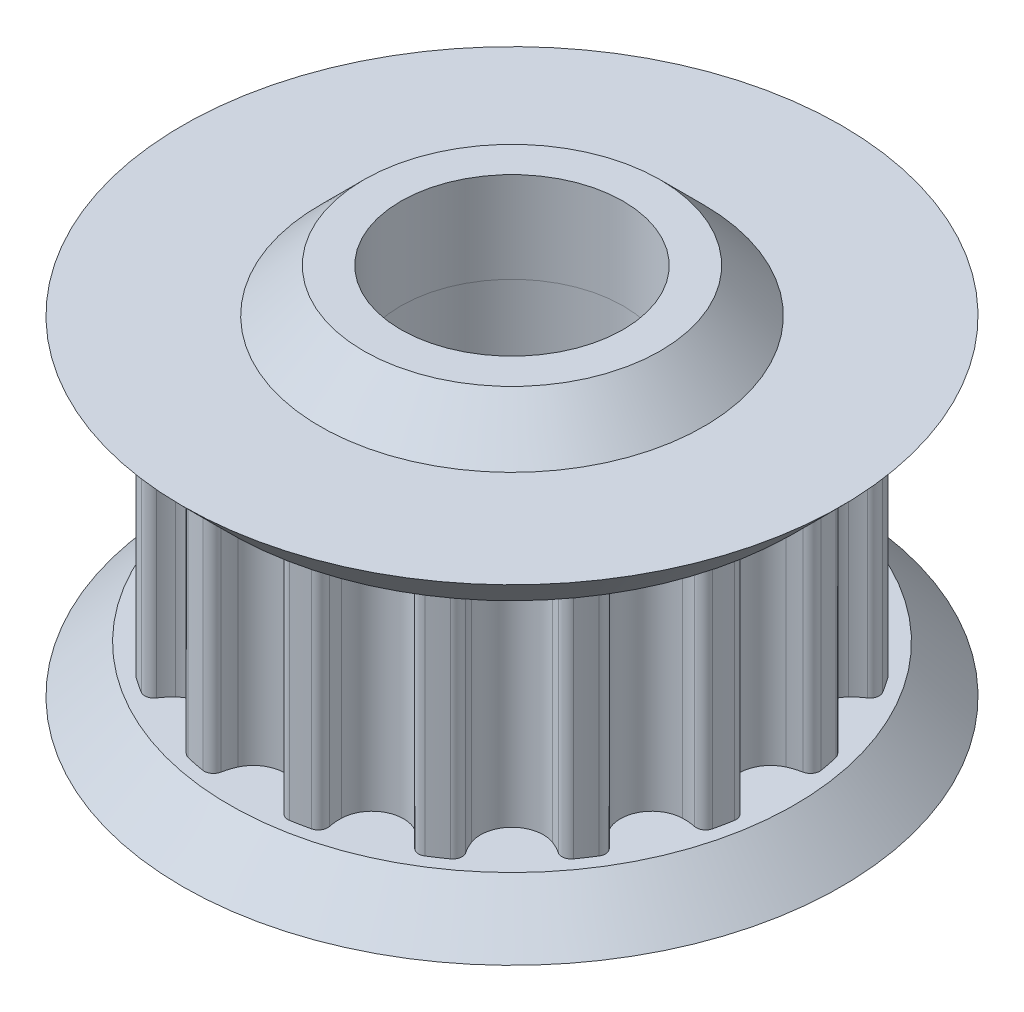
from build123d import *

# Parameters (mm, degrees)
SKETCH1_R           = 3
BOSS_EXTRUDE1_DEPTH = 3.175


with BuildPart() as part:
    # Sketch1 → Boss-Extrude1 (new, symmetric)
    with BuildSketch(Plane(origin=(0, 0, 0), x_dir=(1, 0, 0), z_dir=(0, 1, 0))):
        with BuildLine():
            ThreePointArc((-1.850768, -6.777037356), (-1.816941892, -6.962421006), (-1.663291889, -7.071521784))
            ThreePointArc((-1.663291889, -7.071521784), (-1.417233644, -7.124914669), (-1.169472895, -7.169748489))
            ThreePointArc((-1.169472895, -7.169748489), (-0.985767742, -7.127751824), (-0.883573242, -6.969424355))
            ThreePointArc((-0.883573242, -6.969424355), (-0.839120956, -6.792881518), (-0.773880597, -6.622919538))
            ThreePointArc((-0.773880597, -6.622919538), (0, -6.1245), (0.773880597, -6.622919538))
            ThreePointArc((0.773880597, -6.622919538), (0.839120956, -6.792881518), (0.883573242, -6.969424355))
            ThreePointArc((0.883573242, -6.969424355), (0.985767742, -7.127751824), (1.169472895, -7.169748489))
            ThreePointArc((1.169472895, -7.169748489), (1.417233644, -7.124914669), (1.663291889, -7.071521784))
            ThreePointArc((1.663291889, -7.071521784), (1.816941892, -6.962421006), (1.850768, -6.777037356))
            ThreePointArc((1.850768, -6.777037356), (1.824276538, -6.596921889), (1.819509137, -6.414931089))
            ThreePointArc((1.819509137, -6.414931089), (2.343744682, -5.658300197), (3.249454025, -5.822628523))
            ThreePointArc((3.249454025, -5.822628523), (3.374769892, -5.954686513), (3.483398468, -6.100779674))
            ThreePointArc((3.483398468, -6.100779674), (3.638403174, -6.20794704), (3.824196033, -6.176445981))
            ThreePointArc((3.824196033, -6.176445981), (4.035939958, -6.040210999), (4.242835561, -5.896719991))
            ThreePointArc((4.242835561, -5.896719991), (4.343038594, -5.737124705), (4.303346591, -5.552907854))
            ThreePointArc((4.303346591, -5.552907854), (4.209944466, -5.396640704), (4.135895098, -5.230327534))
            ThreePointArc((4.135895098, -5.230327534), (4.330675481, -4.330675481), (5.230327534, -4.135895098))
            ThreePointArc((5.230327534, -4.135895098), (5.396640704, -4.209944466), (5.552907854, -4.303346591))
            ThreePointArc((5.552907854, -4.303346591), (5.737124705, -4.343038594), (5.896719991, -4.242835561))
            ThreePointArc((5.896719991, -4.242835561), (6.040210999, -4.035939958), (6.176445981, -3.824196033))
            ThreePointArc((6.176445981, -3.824196033), (6.20794704, -3.638403174), (6.100779674, -3.483398468))
            ThreePointArc((6.100779674, -3.483398468), (5.954686513, -3.374769892), (5.822628523, -3.249454025))
            ThreePointArc((5.822628523, -3.249454025), (5.658300197, -2.343744682), (6.414931089, -1.819509137))
            ThreePointArc((6.414931089, -1.819509137), (6.596921889, -1.824276538), (6.777037356, -1.850768))
            ThreePointArc((6.777037356, -1.850768), (6.962421006, -1.816941892), (7.071521784, -1.663291889))
            ThreePointArc((7.071521784, -1.663291889), (7.124914669, -1.417233644), (7.169748489, -1.169472895))
            ThreePointArc((7.169748489, -1.169472895), (7.127751824, -0.985767742), (6.969424355, -0.883573242))
            ThreePointArc((6.969424355, -0.883573242), (6.792881518, -0.839120956), (6.622919538, -0.773880597))
            ThreePointArc((6.622919538, -0.773880597), (6.1245, 0), (6.622919538, 0.773880597))
            ThreePointArc((6.622919538, 0.773880597), (6.792881518, 0.839120956), (6.969424355, 0.883573242))
            ThreePointArc((6.969424355, 0.883573242), (7.127751824, 0.985767742), (7.169748489, 1.169472895))
            ThreePointArc((7.169748489, 1.169472895), (7.124914669, 1.417233644), (7.071521784, 1.663291889))
            ThreePointArc((7.071521784, 1.663291889), (6.962421006, 1.816941892), (6.777037356, 1.850768))
            ThreePointArc((6.777037356, 1.850768), (6.596921889, 1.824276538), (6.414931089, 1.819509137))
            ThreePointArc((6.414931089, 1.819509137), (5.658300197, 2.343744682), (5.822628523, 3.249454025))
            ThreePointArc((5.822628523, 3.249454025), (5.954686513, 3.374769892), (6.100779674, 3.483398468))
            ThreePointArc((6.100779674, 3.483398468), (6.20794704, 3.638403174), (6.176445981, 3.824196033))
            ThreePointArc((6.176445981, 3.824196033), (6.040210999, 4.035939958), (5.896719991, 4.242835561))
            ThreePointArc((5.896719991, 4.242835561), (5.737124705, 4.343038594), (5.552907854, 4.303346591))
            ThreePointArc((5.552907854, 4.303346591), (5.396640704, 4.209944466), (5.230327534, 4.135895098))
            ThreePointArc((5.230327534, 4.135895098), (4.330675481, 4.330675481), (4.135895098, 5.230327534))
            ThreePointArc((4.135895098, 5.230327534), (4.209944466, 5.396640704), (4.303346591, 5.552907854))
            ThreePointArc((4.303346591, 5.552907854), (4.343038594, 5.737124705), (4.242835561, 5.896719991))
            ThreePointArc((4.242835561, 5.896719991), (4.035939958, 6.040210999), (3.824196033, 6.176445981))
            ThreePointArc((3.824196033, 6.176445981), (3.638403174, 6.20794704), (3.483398468, 6.100779674))
            ThreePointArc((3.483398468, 6.100779674), (3.374769892, 5.954686513), (3.249454025, 5.822628523))
            ThreePointArc((3.249454025, 5.822628523), (2.343744682, 5.658300197), (1.819509137, 6.414931089))
            ThreePointArc((1.819509137, 6.414931089), (1.824276538, 6.596921889), (1.850768, 6.777037356))
            ThreePointArc((1.850768, 6.777037356), (1.816941892, 6.962421006), (1.663291889, 7.071521784))
            ThreePointArc((1.663291889, 7.071521784), (1.417233644, 7.124914669), (1.169472895, 7.169748489))
            ThreePointArc((1.169472895, 7.169748489), (0.985767742, 7.127751824), (0.883573242, 6.969424355))
            ThreePointArc((0.883573242, 6.969424355), (0.839120956, 6.792881518), (0.773880597, 6.622919538))
            ThreePointArc((0.773880597, 6.622919538), (0, 6.1245), (-0.773880597, 6.622919538))
            ThreePointArc((-0.773880597, 6.622919538), (-0.839120956, 6.792881518), (-0.883573242, 6.969424355))
            ThreePointArc((-0.883573242, 6.969424355), (-0.985767742, 7.127751824), (-1.169472895, 7.169748489))
            ThreePointArc((-1.169472895, 7.169748489), (-1.417233644, 7.124914669), (-1.663291889, 7.071521784))
            ThreePointArc((-1.663291889, 7.071521784), (-1.816941892, 6.962421006), (-1.850768, 6.777037356))
            ThreePointArc((-1.850768, 6.777037356), (-1.824276538, 6.596921889), (-1.819509137, 6.414931089))
            ThreePointArc((-1.819509137, 6.414931089), (-2.343744682, 5.658300197), (-3.249454025, 5.822628523))
            ThreePointArc((-3.249454025, 5.822628523), (-3.374769892, 5.954686513), (-3.483398468, 6.100779674))
            ThreePointArc((-3.483398468, 6.100779674), (-3.638403174, 6.20794704), (-3.824196033, 6.176445981))
            ThreePointArc((-3.824196033, 6.176445981), (-4.035939958, 6.040210999), (-4.242835561, 5.896719991))
            ThreePointArc((-4.242835561, 5.896719991), (-4.343038594, 5.737124705), (-4.303346591, 5.552907854))
            ThreePointArc((-4.303346591, 5.552907854), (-4.209944466, 5.396640704), (-4.135895098, 5.230327534))
            ThreePointArc((-4.135895098, 5.230327534), (-4.330675481, 4.330675481), (-5.230327534, 4.135895098))
            ThreePointArc((-5.230327534, 4.135895098), (-5.396640704, 4.209944466), (-5.552907854, 4.303346591))
            ThreePointArc((-5.552907854, 4.303346591), (-5.737124705, 4.343038594), (-5.896719991, 4.242835561))
            ThreePointArc((-5.896719991, 4.242835561), (-6.040210999, 4.035939958), (-6.176445981, 3.824196033))
            ThreePointArc((-6.176445981, 3.824196033), (-6.20794704, 3.638403174), (-6.100779674, 3.483398468))
            ThreePointArc((-6.100779674, 3.483398468), (-5.954686513, 3.374769892), (-5.822628523, 3.249454025))
            ThreePointArc((-5.822628523, 3.249454025), (-5.658300197, 2.343744682), (-6.414931089, 1.819509137))
            ThreePointArc((-6.414931089, 1.819509137), (-6.596921889, 1.824276538), (-6.777037356, 1.850768))
            ThreePointArc((-6.777037356, 1.850768), (-6.962421006, 1.816941892), (-7.071521784, 1.663291889))
            ThreePointArc((-7.071521784, 1.663291889), (-7.124914669, 1.417233644), (-7.169748489, 1.169472895))
            ThreePointArc((-7.169748489, 1.169472895), (-7.127751824, 0.985767742), (-6.969424355, 0.883573242))
            ThreePointArc((-6.969424355, 0.883573242), (-6.792881518, 0.839120956), (-6.622919538, 0.773880597))
            ThreePointArc((-6.622919538, 0.773880597), (-6.1245, 0), (-6.622919538, -0.773880597))
            ThreePointArc((-6.622919538, -0.773880597), (-6.792881518, -0.839120956), (-6.969424355, -0.883573242))
            ThreePointArc((-6.969424355, -0.883573242), (-7.127751824, -0.985767742), (-7.169748489, -1.169472895))
            ThreePointArc((-7.169748489, -1.169472895), (-7.124914669, -1.417233644), (-7.071521784, -1.663291889))
            ThreePointArc((-7.071521784, -1.663291889), (-6.962421006, -1.816941892), (-6.777037356, -1.850768))
            ThreePointArc((-6.777037356, -1.850768), (-6.596921889, -1.824276538), (-6.414931089, -1.819509137))
            ThreePointArc((-6.414931089, -1.819509137), (-5.658300197, -2.343744682), (-5.822628523, -3.249454025))
            ThreePointArc((-5.822628523, -3.249454025), (-5.954686513, -3.374769892), (-6.100779674, -3.483398468))
            ThreePointArc((-6.100779674, -3.483398468), (-6.20794704, -3.638403174), (-6.176445981, -3.824196033))
            ThreePointArc((-6.176445981, -3.824196033), (-6.040210999, -4.035939958), (-5.896719991, -4.242835561))
            ThreePointArc((-5.896719991, -4.242835561), (-5.737124705, -4.343038594), (-5.552907854, -4.303346591))
            ThreePointArc((-5.552907854, -4.303346591), (-5.396640704, -4.209944466), (-5.230327534, -4.135895098))
            ThreePointArc((-5.230327534, -4.135895098), (-4.330675481, -4.330675481), (-4.135895098, -5.230327534))
            ThreePointArc((-4.135895098, -5.230327534), (-4.209944466, -5.396640704), (-4.303346591, -5.552907854))
            ThreePointArc((-4.303346591, -5.552907854), (-4.343038594, -5.737124705), (-4.242835561, -5.896719991))
            ThreePointArc((-4.242835561, -5.896719991), (-4.035939958, -6.040210999), (-3.824196033, -6.176445981))
            ThreePointArc((-3.824196033, -6.176445981), (-3.638403174, -6.20794704), (-3.483398468, -6.100779674))
            ThreePointArc((-3.483398468, -6.100779674), (-3.374769892, -5.954686513), (-3.249454025, -5.822628523))
            ThreePointArc((-3.249454025, -5.822628523), (-2.343744682, -5.658300197), (-1.819509137, -6.414931089))
            ThreePointArc((-1.819509137, -6.414931089), (-1.824276538, -6.596921889), (-1.850768, -6.777037356))
        make_face()
        Circle(SKETCH1_R, mode=Mode.SUBTRACT)
    extrude(amount=BOSS_EXTRUDE1_DEPTH, both=True)


with BuildPart() as body_2:
    # Sketch4 → Revolve1 (revolve)
    with BuildSketch(Plane.XY):
        Polygon((-7.62, 3.175), (-3, 3.175), (-3, 5.62102), (-4, 5.62102), (-5.17602, 4.445), (-8.89, 4.445), align=None)
        Polygon((-7.62, -3.175), (-8.89, -4.445), (-5.27, -4.445), (-4, -5.715), (-3, -5.715), (-3, -3.175), align=None)
    revolve(axis=Axis((0, 0, 0), (0, 1, 0)))


solid = Compound([part.part, body_2.part])
